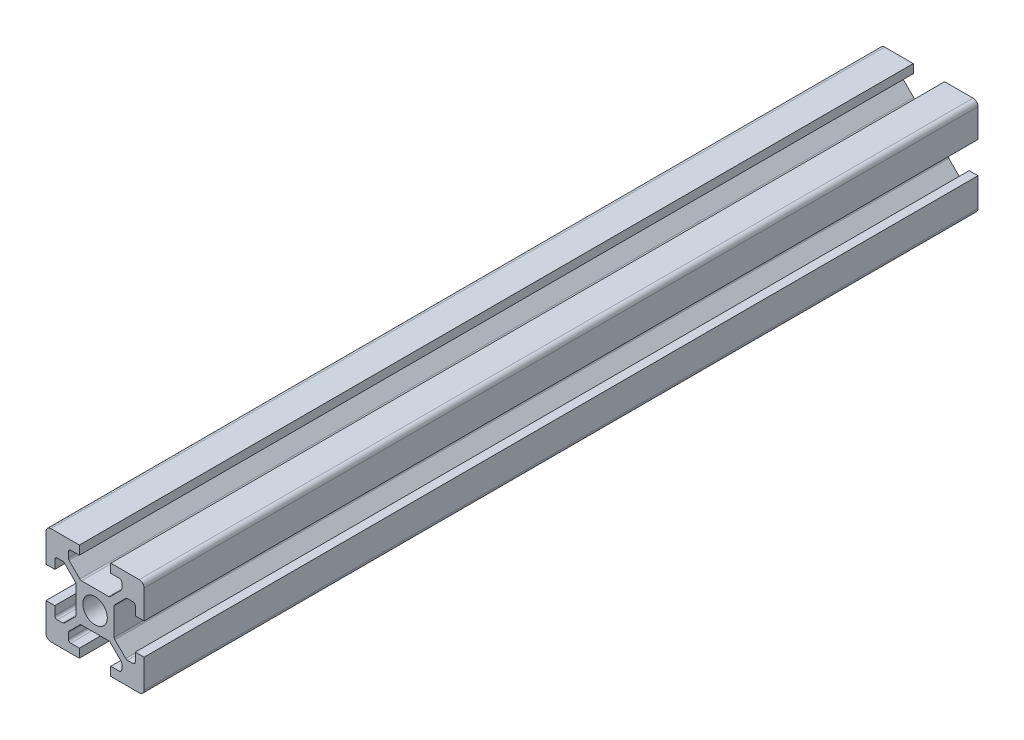
from build123d import *

# Parameters (mm, degrees)
SKETCH1_R           = 2.5
BOSS_EXTRUDE1_DEPTH = 170
FILLET1_R           = 1
FILLET2_R           = 0.5
FILLET3_R           = 0.5
FILLET4_R           = 0.5
FILLET5_R           = 0.5


with BuildPart() as part:
    # Sketch1 → Boss-Extrude1 (new body)
    with BuildSketch(Plane.XY):
        Polygon((0, 6.8), (0, 0), (6.8, 0), (6.8, 1.8), (4.55, 1.8), (4.55, 3.6), (7.05, 6.1), (12.95, 6.1), (15.45, 3.6), (15.45, 1.8), (13.2, 1.8), (13.2, 0), (20, 0), (20, 6.8), (18.2, 6.8), (18.2, 4.55), (16.4, 4.55), (13.9, 7.05), (13.9, 12.95), (16.4, 15.45), (18.2, 15.45), (18.2, 13.2), (20, 13.2), (20, 20), (13.2, 20), (13.2, 18.2), (15.45, 18.2), (15.45, 16.4), (12.95, 13.9), (7.05, 13.9), (4.55, 16.4), (4.55, 18.2), (6.8, 18.2), (6.8, 20), (0, 20), (0, 13.2), (1.8, 13.2), (1.8, 15.45), (3.6, 15.45), (6.1, 12.95), (6.1, 7.05), (3.6, 4.55), (1.8, 4.55), (1.8, 6.8), align=None)
        with Locations((10, 10)):
            Circle(SKETCH1_R, mode=Mode.SUBTRACT)
    extrude(amount=BOSS_EXTRUDE1_DEPTH)

    # Fillet1
    fillet1_edges = [part.edges().sort_by_distance(p)[0] for p in [
        (20, 20, 85),
        (20, 0, 85),
        (0, 0, 85),
        (0, 20, 85),
    ]]
    fillet(fillet1_edges, radius=FILLET1_R)

    # Fillet2
    fillet2_edges = [part.edges().sort_by_distance(p)[0] for p in [
        (4.55, 18.2, 85),
        (4.55, 16.4, 85),
        (7.05, 13.9, 85),
        (15.45, 18.2, 85),
        (15.45, 16.4, 85),
        (12.95, 13.9, 85),
    ]]
    fillet(fillet2_edges, radius=FILLET2_R)

    # Fillet3
    fillet3_edges = [part.edges().sort_by_distance(p)[0] for p in [
        (18.2, 15.45, 85),
        (16.4, 15.45, 85),
        (13.9, 12.95, 85),
        (18.2, 4.55, 85),
        (13.9, 7.05, 85),
        (16.4, 4.55, 85),
    ]]
    fillet(fillet3_edges, radius=FILLET3_R)

    # Fillet4
    fillet4_edges = [part.edges().sort_by_distance(p)[0] for p in [
        (1.8, 15.45, 85),
        (3.6, 15.45, 85),
        (6.1, 12.95, 85),
        (3.6, 4.55, 85),
        (1.8, 4.55, 85),
        (6.1, 7.05, 85),
    ]]
    fillet(fillet4_edges, radius=FILLET4_R)

    # Fillet5
    fillet5_edges = [part.edges().sort_by_distance(p)[0] for p in [
        (7.05, 6.1, 85),
        (4.55, 3.6, 85),
        (4.55, 1.8, 85),
        (15.45, 1.8, 85),
        (15.45, 3.6, 85),
        (12.95, 6.1, 85),
    ]]
    fillet(fillet5_edges, radius=FILLET5_R)


solid = part.part
